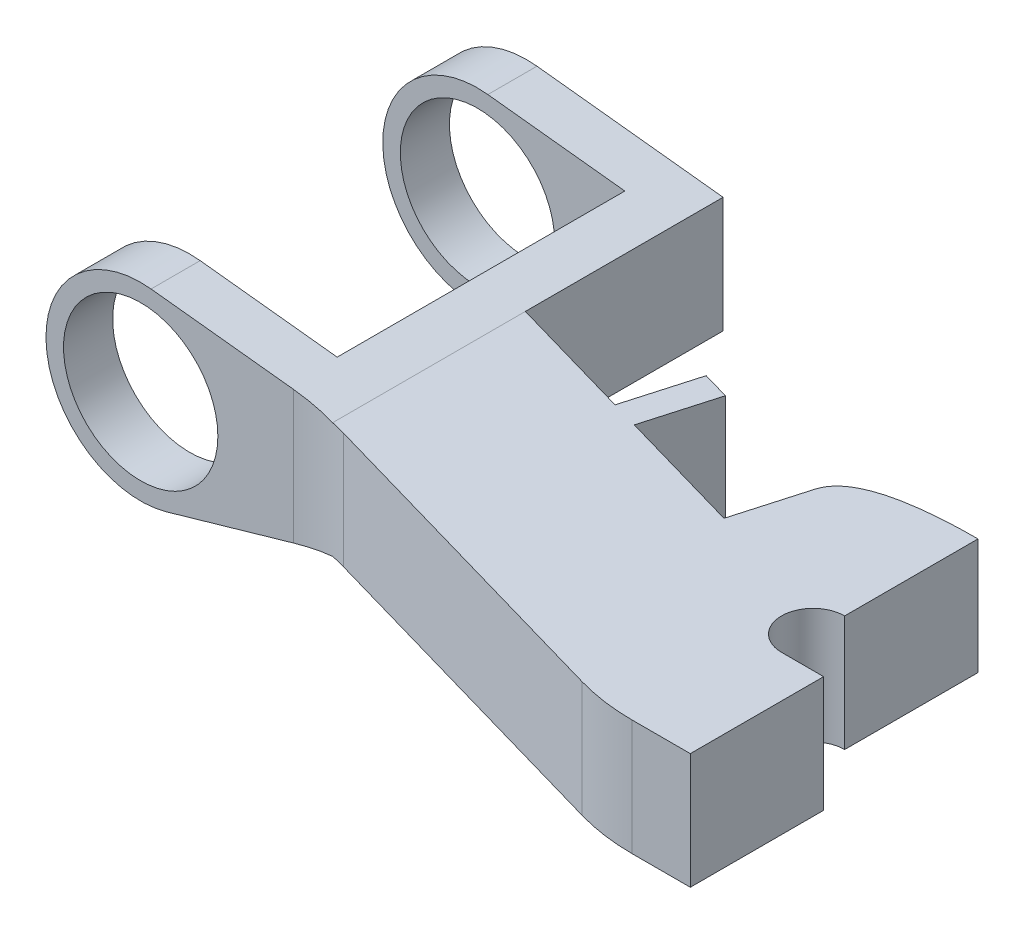
from build123d import *

# Parameters (mm, degrees)
EXTRUDE_1_DEPTH          = 13.5
CUT_EXTRUDE_1_DEPTH      = 136.073128486
CUT_EXTRUDE_1_DEPTH_BACK = 136.073128486
SKETCH_11_R              = 11
SKETCH_12_R              = 2.5
EXTRUDE_2_DEPTH          = 4.5
SKETCH_13_R              = 2.5
EXTRUDE_3_DEPTH          = 4.5
FILLET_1_R               = 30


with BuildPart() as part:
    # Эскиз10 → Бобышка-Вытянуть1 (new, symmetric)
    with BuildSketch(Plane(origin=(0, 0, 0), x_dir=(1, 0, 0), z_dir=(0, 1, 0))):
        with BuildLine():
            Line((-78, 61.5), (-92.5, 61.5))
            Line((-92.5, 61.5), (-119.5, 61.5))
            Line((-119.5, 61.5), (-119.5, 54.5))
            Line((-119.5, 54.5), (-92.5, 54.5))
            Line((-92.5, 54.5), (-85, 54.5))
            Line((-85, 54.5), (-85, 13.5))
            Line((-85, 13.5), (-92.5, 13.5))
            Line((-92.5, 13.5), (-119.5, 13.5))
            Line((-119.5, 13.5), (-119.5, 6.5))
            Line((-119.5, 6.5), (-92.5, 6.5))
            Line((-92.5, 6.5), (-79.982946496, 6.5))
            Line((-79.982946496, 6.5), (-52.083630945, -1.5))
            Line((-52.083630945, -1.5), (-24.184315394, -9.5))
            Line((-24.184315394, -9.5), (-11.66726189, -9.5))
            Line((-11.66726189, -9.5), (-11.66726189, 9.5))
            Line((-11.66726189, 9.5), (-17.66726189, 9.5))
            ThreePointArc((-17.66726189, 9.5), (-22.16726189, 14), (-17.66726189, 18.5))
            Line((-17.66726189, 18.5), (-17.66726189, 37.5))
            add(Edge.make_bspline(
                [(-35.41795442, 32.036211278), (-33.851238215, 37.5), (-17.66726189, 37.5)],
                knots=[0, 0, 0, 1, 1, 1], degree=2))
            Line((-35.41795442, 32.036211278), (-38.312146656, 21.942963471))
            Line((-38.312146656, 21.942963471), (-56.233549936, 27.081843168))
            Line((-56.233549936, 27.081843168), (-53.3393577, 37.175090975))
            Line((-53.3393577, 37.175090975), (-57.184404484, 38.277640398))
            Line((-57.184404484, 38.277640398), (-60.07859672, 28.184392591))
            Line((-60.07859672, 28.184392591), (-78, 33.323272288))
            Line((-78, 33.323272288), (-78, 61.5))
        make_face()
    extrude(amount=EXTRUDE_1_DEPTH, both=True)

    # Эскиз11 → Вырез-Вытянуть1 (cut, two sides: drawn at the far end of the back side and taken through both)
    with BuildSketch(Plane.XY.offset(-CUT_EXTRUDE_1_DEPTH_BACK)):
        with BuildLine():
            Line((-11.66726189, -13.5), (-11.66726189, -6))
            Line((-11.66726189, -6), (-78, -6))
            Line((-78, -6), (-102.271403318, -12.974882149))
            ThreePointArc((-102.271403318, -12.974882149), (-104.117303664, -13.368075946), (-106, -13.5))
            Line((-106, -13.5), (-11.66726189, -13.5))
        make_face()
        with BuildLine():
            Line((-78, 10.5), (-11.66726189, 10.5))
            Line((-11.66726189, 10.5), (-11.66726189, 13.5))
            Line((-11.66726189, 13.5), (-106, 13.5))
            ThreePointArc((-106, 13.5), (-105.260484121, 13.479729829), (-104.523188999, 13.418980187))
            Line((-104.523188999, 13.418980187), (-78, 10.5))
        make_face()
        with BuildLine():
            Line((-119.5, -13.5), (-106, -13.5))
            ThreePointArc((-106, -13.5), (-115.545941546, -9.545941546), (-119.5, 0))
            Line((-119.5, 0), (-119.5, -13.5))
        make_face()
        with BuildLine():
            ThreePointArc((-119.5, 0), (-115.545941546, 9.545941546), (-106, 13.5))
            Line((-106, 13.5), (-119.5, 13.5))
            Line((-119.5, 13.5), (-119.5, 0))
        make_face()
        with Locations((-106, 0)):
            Circle(SKETCH_11_R)
    extrude(amount=CUT_EXTRUDE_1_DEPTH + CUT_EXTRUDE_1_DEPTH_BACK, mode=Mode.SUBTRACT)

    # Эскиз12 → Бобышка-Вытянуть2 (add)
    with BuildSketch(Plane(origin=(-62.981794436, 0, -18.059738941), x_dir=(-0.2756373558168036, 0, 0.961261695938375), z_dir=(-0.961261695938375, 0, -0.2756373558168036))):
        with Locations((-18.53267148, 2.25)):
            Circle(SKETCH_12_R)
    extrude(amount=EXTRUDE_2_DEPTH)

    # Эскиз13 → Бобышка-Вытянуть3 (add)
    with BuildSketch(Plane(origin=(-41.215344372, 0, -11.818309821), x_dir=(-0.2756373558168751, 0, 0.9612616959383545), z_dir=(-0.9612616959383545, 0, -0.2756373558168751))):
        with Locations((-18.53267148, 2.25)):
            Circle(SKETCH_13_R)
    extrude(amount=EXTRUDE_3_DEPTH)

    # Скругление1
    fillet_1_edges = [part.edges().sort_by_distance(p)[0] for p in [
        (-24.184315394, 2.25, 9.5),
        (-79.982946496, 2.074195456, -6.5),
    ]]
    fillet(fillet_1_edges, radius=FILLET_1_R)


solid = part.part
